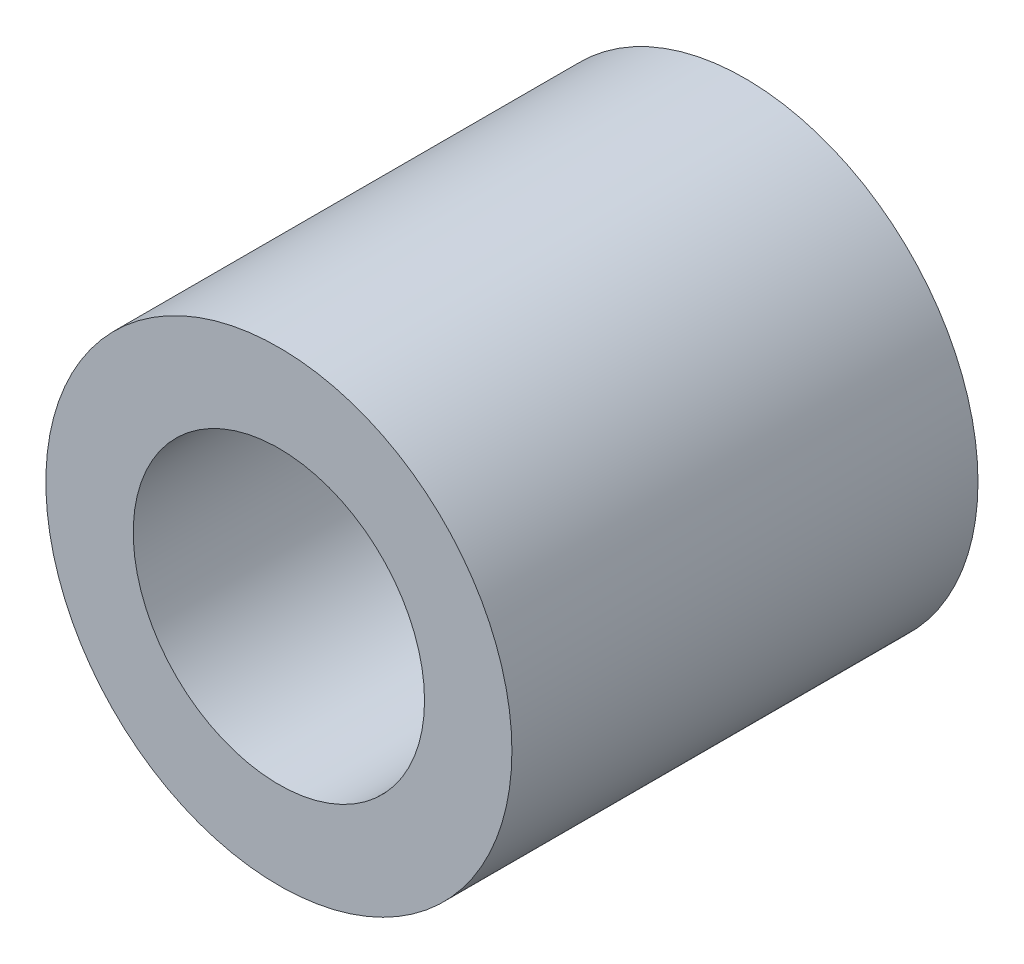
from build123d import *

# Parameters (mm, degrees)
IZIM1_R                     = 0.8
IZIM1_R_2                   = 0.5
Y_KSEKLIK_EKSTR_ZYON1_DEPTH = 1.6


with BuildPart() as part:
    # Çizim1 → Yükseklik-Ekstrüzyon1 (new body)
    with BuildSketch(Plane.XY):
        Circle(IZIM1_R)
        Circle(IZIM1_R_2, mode=Mode.SUBTRACT)
    extrude(amount=Y_KSEKLIK_EKSTR_ZYON1_DEPTH)


solid = part.part
